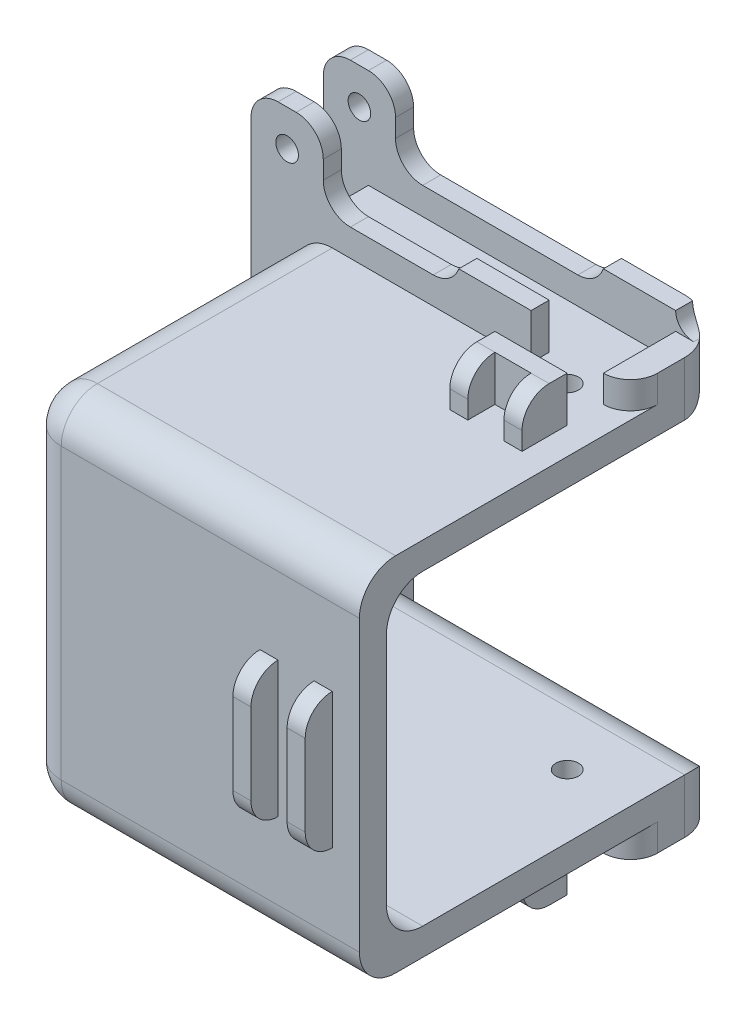
from build123d import *

# Parameters (mm, degrees)
ESTRUSIONE_ESTRUSIONE1_DEPTH  = 10
SCHIZZO6_W                    = 8
SCHIZZO6_H                    = 8
SCHIZZO6_H_2                  = 2
ESTRUSIONE_ESTRUSIONE4_DEPTH  = 10
TAGLIO_ESTRUSIONE1_DEPTH      = 54.150729064
SCHIZZO4_W                    = 3
SCHIZZO4_H                    = 6
ESTRUSIONE_ESTRUSIONE2_DEPTH  = 3
SCHIZZO5_W                    = 3
SCHIZZO5_H                    = 6
ESTRUSIONE_ESTRUSIONE3_DEPTH  = 3
SCHIZZO3_W                    = 5
SCHIZZO3_H                    = 6
TAGLIO_ESTRUSIONE2_DEPTH      = 67.820655489
FORO_FILETTATO_M3X0_5_1_D     = 2.5
ESTRUSIONE_ESTRUSIONE5_DEPTH  = 30
SCHIZZO10_W                   = 3
SCHIZZO10_H                   = 34
ESTRUSIONE_ESTRUSIONE6_DEPTH  = 34
SCHIZZO18_W                   = 8
SCHIZZO18_H                   = 8
TAGLIO_ESTRUSIONE3_DEPTH      = 5
SCHIZZO24_W                   = 8
SCHIZZO24_H                   = 2
ESTRUSIONE_ESTRUSIONE9_DEPTH  = 5
SCHIZZO23_W                   = 8
SCHIZZO23_H                   = 8
TAGLIO_ESTRUSIONE4_DEPTH      = 5
SCHIZZO25_W                   = 8
SCHIZZO25_H                   = 2
ESTRUSIONE_ESTRUSIONE10_DEPTH = 5
FORO_FILETTATO_M3X0_5_4_D     = 2.5
FORO_FILETTATO_M3X0_5_4_DEPTH = 7.5
FORO_FILETTATO_M3X0_5_4_TIP   = 0.751075774
FORO_FILETTATO_M3X0_5_5_D     = 2.5
FORO_FILETTATO_M3X0_5_5_DEPTH = 7.5
FORO_FILETTATO_M3X0_5_5_TIP   = 0.751075774
SCHIZZO11_W                   = 2
SCHIZZO11_H                   = 15
ESTRUSIONE_ESTRUSIONE7_DEPTH  = 3
SCHIZZO12_W                   = 2
SCHIZZO12_H                   = 5
ESTRUSIONE_ESTRUSIONE8_DEPTH  = 3
SCHIZZO28_W                   = 8
SCHIZZO28_H                   = 2
ESTRUSIONE_ESTRUSIONE11_DEPTH = 2
SCHIZZO29_W                   = 8
SCHIZZO29_H                   = 2
ESTRUSIONE_ESTRUSIONE12_DEPTH = 2
RACCORDO1_R                   = 4
RACCORDO2_R                   = 3
RACCORDO30_R                  = 2


# Some blends are built 0.0001 mm under size
with BuildPart() as part:
    # Schizzo1 → Estrusione-Estrusione1 (new body)
    with BuildSketch(Plane.XY):
        Polygon((0, -23), (42, -23), (42, -17), (8, -17), (8, 17), (42, 17), (42, 23), (0, 23), align=None)
    extrude(amount=ESTRUSIONE_ESTRUSIONE1_DEPTH)

    # Schizzo6 → Estrusione-Estrusione4 (add)
    with BuildSketch(Plane.XY.offset(10)):
        with Locations((4, -27)):
            Rectangle(SCHIZZO6_W, SCHIZZO6_H)
        with Locations((4, 27)):
            Rectangle(SCHIZZO6_W, SCHIZZO6_H)
        with Locations((35, -24)):
            Rectangle(SCHIZZO6_W, SCHIZZO6_H_2)
        with Locations((35, 24)):
            Rectangle(SCHIZZO6_W, SCHIZZO6_H_2)
    extrude(amount=-ESTRUSIONE_ESTRUSIONE4_DEPTH)

    # Schizzo2 → Taglio-Estrusione1 (cut, through all)
    with BuildSketch(Plane(origin=(42, 0, 0), x_dir=(0, 0, -1), z_dir=(1, 0, 0))):
        Polygon((-8, -23), (-8, -41.817102562), (-2, -41.817102562), (-2, -22.5), (-2, -20), (-8, -20), align=None)
    taglio_estrusione1 = extrude(amount=-TAGLIO_ESTRUSIONE1_DEPTH, mode=Mode.SUBTRACT)

    # Schizzo4 → Estrusione-Estrusione2 (add)
    with BuildSketch(Plane(origin=(0, -20, 0), x_dir=(-1, 0, 0), z_dir=(0, -1, 0))):
        with Locations((-40.5, -5)):
            Rectangle(SCHIZZO4_W, SCHIZZO4_H)
    extrude(amount=ESTRUSIONE_ESTRUSIONE2_DEPTH)

    # Specchia1: Taglio-Estrusione1 across plane
    add(taglio_estrusione1.mirror(Plane.ZX), mode=Mode.SUBTRACT)

    # Schizzo5 → Estrusione-Estrusione3 (add)
    with BuildSketch(Plane(origin=(0, 20, 0), x_dir=(1, 0, 0), z_dir=(0, 1, 0))):
        with Locations((40.5, -5)):
            Rectangle(SCHIZZO5_W, SCHIZZO5_H)
    extrude(amount=ESTRUSIONE_ESTRUSIONE3_DEPTH)

    # Schizzo3 → Taglio-Estrusione2 (cut, through all)
    with BuildSketch(Plane.XZ.offset(20)):
        with Locations((2.5, 5)):
            Rectangle(SCHIZZO3_W, SCHIZZO3_H)
    extrude(amount=-TAGLIO_ESTRUSIONE2_DEPTH, mode=Mode.SUBTRACT)

    # Foro filettato M3x0.5-1 (through all)
    with Locations(Plane.XY.offset(10)):
        with Locations((4, -27), (4, 27)):
            Hole(FORO_FILETTATO_M3X0_5_1_D / 2)

    # Schizzo9 → Estrusione-Estrusione5 (add)
    with BuildSketch(Plane.XY.offset(10)):
        Polygon((5, -20), (42, -20), (42, -17), (8, -17), (8, 17), (42, 17), (42, 20), (5, 20), align=None)
    extrude(amount=ESTRUSIONE_ESTRUSIONE5_DEPTH)

    # Schizzo10 → Estrusione-Estrusione6 (add)
    with BuildSketch(Plane(origin=(8, 0, 0), x_dir=(0, 0, -1), z_dir=(1, 0, 0))):
        with Locations((-38.5, 0)):
            Rectangle(SCHIZZO10_W, SCHIZZO10_H)
    extrude(amount=ESTRUSIONE_ESTRUSIONE6_DEPTH)

    # Schizzo18 → Taglio-Estrusione3 (cut)
    with BuildSketch(Plane.XZ.offset(25)):
        with Locations((35, 12)):
            Rectangle(SCHIZZO18_W, SCHIZZO18_H)
    extrude(amount=-TAGLIO_ESTRUSIONE3_DEPTH, mode=Mode.SUBTRACT)

    # Schizzo24 → Estrusione-Estrusione9 (add)
    with BuildSketch(Plane.XZ.offset(20)):
        with Locations((35, 15)):
            Rectangle(SCHIZZO24_W, SCHIZZO24_H)
    extrude(amount=ESTRUSIONE_ESTRUSIONE9_DEPTH)

    # Schizzo23 → Taglio-Estrusione4 (cut)
    with BuildSketch(Plane(origin=(0, 25, 0), x_dir=(1, 0, 0), z_dir=(0, 1, 0))):
        with Locations((35, -12)):
            Rectangle(SCHIZZO23_W, SCHIZZO23_H)
    extrude(amount=-TAGLIO_ESTRUSIONE4_DEPTH, mode=Mode.SUBTRACT)

    # Schizzo25 → Estrusione-Estrusione10 (add)
    with BuildSketch(Plane(origin=(0, 20, 0), x_dir=(1, 0, 0), z_dir=(0, 1, 0))):
        with Locations((35, -15)):
            Rectangle(SCHIZZO25_W, SCHIZZO25_H)
    extrude(amount=ESTRUSIONE_ESTRUSIONE10_DEPTH)

    # Foro filettato M3x0.5-4
    with Locations(Plane(origin=(0, -20, 0), x_dir=(-1, 0, 0), z_dir=(0, -1, 0))):
        with Locations((-35, -10)):
            Hole(FORO_FILETTATO_M3X0_5_4_D / 2, depth=FORO_FILETTATO_M3X0_5_4_DEPTH)
            with Locations((0, 0, -(FORO_FILETTATO_M3X0_5_4_DEPTH + FORO_FILETTATO_M3X0_5_4_TIP / 2))):  # 118° drill point
                Cone(0, FORO_FILETTATO_M3X0_5_4_D / 2, FORO_FILETTATO_M3X0_5_4_TIP, mode=Mode.SUBTRACT)

    # Foro filettato M3x0.5-5
    with Locations(Plane(origin=(0, 20, 0), x_dir=(1, 0, 0), z_dir=(0, 1, 0))):
        with Locations((35, -10)):
            Hole(FORO_FILETTATO_M3X0_5_5_D / 2, depth=FORO_FILETTATO_M3X0_5_5_DEPTH)
            with Locations((0, 0, -(FORO_FILETTATO_M3X0_5_5_DEPTH + FORO_FILETTATO_M3X0_5_5_TIP / 2))):  # 118° drill point
                Cone(0, FORO_FILETTATO_M3X0_5_5_D / 2, FORO_FILETTATO_M3X0_5_5_TIP, mode=Mode.SUBTRACT)

    # Schizzo11 → Estrusione-Estrusione7 (add)
    with BuildSketch(Plane.XY.offset(40)):
        with Locations((38, 0)):
            Rectangle(SCHIZZO11_W, SCHIZZO11_H)
        with Locations((32, 0)):
            Rectangle(SCHIZZO11_W, SCHIZZO11_H)
    extrude(amount=ESTRUSIONE_ESTRUSIONE7_DEPTH)

    # Schizzo12 → Estrusione-Estrusione8 (add)
    with BuildSketch(Plane.XY.offset(16)):
        with Locations((38, -22.5)):
            Rectangle(SCHIZZO12_W, SCHIZZO12_H)
        with Locations((32, -22.5)):
            Rectangle(SCHIZZO12_W, SCHIZZO12_H)
    estrusione_estrusione8 = extrude(amount=ESTRUSIONE_ESTRUSIONE8_DEPTH)

    # Schizzo28 → Estrusione-Estrusione11 (add)
    with BuildSketch(Plane.XZ.offset(23)):
        with Locations((27, 9)):
            Rectangle(SCHIZZO28_W, SCHIZZO28_H)
    extrude(amount=ESTRUSIONE_ESTRUSIONE11_DEPTH)

    # Schizzo29 → Estrusione-Estrusione12 (add)
    with BuildSketch(Plane(origin=(0, 23, 0), x_dir=(1, 0, 0), z_dir=(0, 1, 0))):
        with Locations((27, -9)):
            Rectangle(SCHIZZO29_W, SCHIZZO29_H)
    extrude(amount=ESTRUSIONE_ESTRUSIONE12_DEPTH)

    # Specchia2: Estrusione-Estrusione8 across plane
    add(estrusione_estrusione8.mirror(Plane.ZX))

    # Raccordo1
    raccordo1_edges = [part.edges().sort_by_distance(p)[0] for p in [
        (23.5, -20, 40),
        (23.5, 20, 40),
        (5, 0, 40),
        (5, 20, 25),
        (5, -20, 25),
        (42, 20, 0),
        (42, -20, 0),
        (25, -17, 37),
        (25, -17, 0),
        (25, 17, 37),
        (25, 17, 0),
    ]]
    fillet(raccordo1_edges, radius=RACCORDO1_R)

    # Raccordo2
    # the kernel refuses this fillet: 3 mm, written as the material it adds along each edge
    with BuildSketch(Plane(origin=(8, 23, 9.5), x_dir=(1, 0, 0), z_dir=(0, 0, -1))) as raccordo2_piece_1_section:
        with BuildLine():
            CenterArc((RACCORDO2_R, -RACCORDO2_R), RACCORDO2_R, 90, 90)
            Line((0, -RACCORDO2_R), (0, 0))
            Line((0, 0), (RACCORDO2_R, 0))
        make_face()
    raccordo2_piece_1 = extrude(amount=17, mode=Mode.PRIVATE)
    raccordo2_piece_1 = split(raccordo2_piece_1, bisect_by=Plane(origin=(8, 23, 8), z_dir=(0, 0, 1)), keep=Keep.TOP, mode=Mode.PRIVATE)
    add(raccordo2_piece_1)
    with BuildSketch(Plane(origin=(8, 23, 2), x_dir=(1, 0, 0), z_dir=(0, 0, -1)), Plane(origin=(8, -23, 2), x_dir=(0, -1, 0), z_dir=(0, 0, -1))) as raccordo2_piece_2:
        with BuildLine():
            CenterArc((RACCORDO2_R, -RACCORDO2_R), RACCORDO2_R, 90, 90)
            Line((0, -RACCORDO2_R), (0, 0))
            Line((0, 0), (RACCORDO2_R, 0))
        make_face()
    extrude(amount=2)
    with BuildSketch(Plane(origin=(8, 23, 10), x_dir=(0, 1, 0), z_dir=(0, 0, -1)), Plane(origin=(8, -23, 10), x_dir=(1, 0, 0), z_dir=(0, 0, -1))) as raccordo2_piece_3:
        with BuildLine():
            CenterArc((RACCORDO2_R, RACCORDO2_R), RACCORDO2_R, 180, 90)
            Line((0, RACCORDO2_R), (0, 0))
            Line((0, 0), (RACCORDO2_R, 0))
        make_face()
    extrude(amount=2)
    with BuildSketch(Plane(origin=(8, 23, 17.5), x_dir=(0, 1, 0), z_dir=(0, 0, -1))) as raccordo2_piece_4_section:
        with BuildLine():
            CenterArc((RACCORDO2_R, RACCORDO2_R), RACCORDO2_R, 180, 90)
            Line((0, RACCORDO2_R), (0, 0))
            Line((0, 0), (RACCORDO2_R, 0))
        make_face()
    raccordo2_piece_4 = extrude(amount=17, mode=Mode.PRIVATE)
    raccordo2_piece_4 = split(raccordo2_piece_4, bisect_by=Plane(origin=(8, 23, 2), z_dir=(0, 0, -1)), keep=Keep.TOP, mode=Mode.PRIVATE)
    add(raccordo2_piece_4)
    with BuildSketch(Plane(origin=(8, -23, 9.5), x_dir=(0, -1, 0), z_dir=(0, 0, -1))) as raccordo2_piece_5_section:
        with BuildLine():
            CenterArc((RACCORDO2_R, -RACCORDO2_R), RACCORDO2_R, 90, 90)
            Line((0, -RACCORDO2_R), (0, 0))
            Line((0, 0), (RACCORDO2_R, 0))
        make_face()
    raccordo2_piece_5 = extrude(amount=17, mode=Mode.PRIVATE)
    raccordo2_piece_5 = split(raccordo2_piece_5, bisect_by=Plane(origin=(8, -23, 8), z_dir=(0, 0, 1)), keep=Keep.TOP, mode=Mode.PRIVATE)
    add(raccordo2_piece_5)
    with BuildSketch(Plane(origin=(8, -23, 17.5), x_dir=(1, 0, 0), z_dir=(0, 0, -1))) as raccordo2_piece_6_section:
        with BuildLine():
            CenterArc((RACCORDO2_R, RACCORDO2_R), RACCORDO2_R, 180, 90)
            Line((0, RACCORDO2_R), (0, 0))
            Line((0, 0), (RACCORDO2_R, 0))
        make_face()
    raccordo2_piece_6 = extrude(amount=17, mode=Mode.PRIVATE)
    raccordo2_piece_6 = split(raccordo2_piece_6, bisect_by=Plane(origin=(8, -23, 2), z_dir=(0, 0, -1)), keep=Keep.TOP, mode=Mode.PRIVATE)
    add(raccordo2_piece_6)
    with BuildSketch(Plane(origin=(23, 23, 8), x_dir=(-1, 0, 0), z_dir=(0, 0, 1)), Plane(origin=(31, -23, 2), x_dir=(-1, 0, 0), z_dir=(0, 0, -1))) as raccordo2_piece_7:
        with BuildLine():
            CenterArc((2.828427125, -3), RACCORDO2_R, 90, 70.528779366)
            Line((0, -2), (0, 0))
            Line((0, 0), (2.828427125, 0))
        make_face()
    extrude(amount=2)
    with BuildSketch(Plane(origin=(31, 23, 2), x_dir=(0, 1, 0), z_dir=(0, 0, -1))) as raccordo2_piece_8:
        with BuildLine():
            CenterArc((3, -2.828427125), RACCORDO2_R, 109.471220634, 70.528779366)
            Line((0, -2.828427125), (0, 0))
            Line((0, 0), (2, 0))
        make_face()
    extrude(amount=2)
    with BuildSketch(Plane(origin=(23, -23, 10), x_dir=(0, -1, 0), z_dir=(0, 0, -1))) as raccordo2_piece_9:
        with BuildLine():
            CenterArc((3, 2.828427125), RACCORDO2_R, 180, 70.528779366)
            Line((0, 2.828427125), (0, 0))
            Line((0, 0), (2, 0))
        make_face()
    extrude(amount=2)
    # the kernel refuses this fillet: 3 mm, written as the material it takes off along each edge
    with BuildSketch(Plane(origin=(23.5, 25, 19), x_dir=(0, 0, -1), z_dir=(1, 0, 0)), Plane(origin=(40.5, 7.5, 43), x_dir=(0, -1, 0), z_dir=(-1, 0, 0)), Plane(origin=(23.5, -7.5, 43), x_dir=(0, 1, 0), z_dir=(1, 0, 0)), Plane(origin=(46.5, -7.5, 43), x_dir=(0, 0, -1), z_dir=(-1, 0, 0)), Plane(origin=(46.5, -25, 19), x_dir=(0, 0, -1), z_dir=(-1, 0, 0)), Plane(origin=(8, -31, 17.5), x_dir=(0, 1, 0), z_dir=(0, 0, -1)), Plane(origin=(0, -31, 17.5), x_dir=(1, 0, 0), z_dir=(0, 0, -1)), Plane(origin=(0, 31, 17.5), x_dir=(0, -1, 0), z_dir=(0, 0, -1)), Plane(origin=(8, 31, 17.5), x_dir=(-1, 0, 0), z_dir=(0, 0, -1))) as raccordo2_2_piece_1:
        with BuildLine():
            CenterArc((RACCORDO2_R, -RACCORDO2_R), RACCORDO2_R, 90, 90)
            Line((0, -RACCORDO2_R), (0, 0))
            Line((0, 0), (RACCORDO2_R, 0))
        make_face()
    extrude(amount=17, mode=Mode.SUBTRACT)
    with BuildSketch(Plane(origin=(46.5, 25, 19), x_dir=(0, 0, -1), z_dir=(-1, 0, 0)), Plane(origin=(29.5, 7.5, 43), x_dir=(0, -1, 0), z_dir=(1, 0, 0)), Plane(origin=(23.5, -25, 19), x_dir=(0, 0, -1), z_dir=(1, 0, 0)), Plane(origin=(8, -31, 9.5), x_dir=(-1, 0, 0), z_dir=(0, 0, -1)), Plane(origin=(0, -31, 9.5), x_dir=(0, 1, 0), z_dir=(0, 0, -1)), Plane(origin=(0, 31, 9.5), x_dir=(1, 0, 0), z_dir=(0, 0, -1)), Plane(origin=(8, 31, 9.5), x_dir=(0, -1, 0), z_dir=(0, 0, -1))) as raccordo2_2_piece_2:
        with BuildLine():
            CenterArc((RACCORDO2_R, RACCORDO2_R), RACCORDO2_R, 180, 90)
            Line((0, RACCORDO2_R), (0, 0))
            Line((0, 0), (RACCORDO2_R, 0))
        make_face()
    extrude(amount=17, mode=Mode.SUBTRACT)
    with BuildSketch(Plane(origin=(42, 20, 10), x_dir=(-1, 0, 0), z_dir=(0, 1, 0)), Plane(origin=(42, -30.5, 10), x_dir=(-1, 0, 0), z_dir=(0, 1, 0))) as raccordo2_2_piece_3:
        with BuildLine():
            CenterArc((RACCORDO2_R, -RACCORDO2_R), RACCORDO2_R, 90, 90)
            Line((0, -RACCORDO2_R), (0, 0))
            Line((0, 0), (RACCORDO2_R, 0))
        make_face()
    extrude(amount=10.5, mode=Mode.SUBTRACT)

    # Raccordo30
    raccordo30_edges = [part.edges().sort_by_distance(p)[0] for p in [
        (39, 23, 1.063508327),
        (39, -23, 1.063508327),
    ]]
    fillet(raccordo30_edges, radius=RACCORDO30_R - 0.0001)  # a hair under: the kernel refuses the full size


solid = part.part
